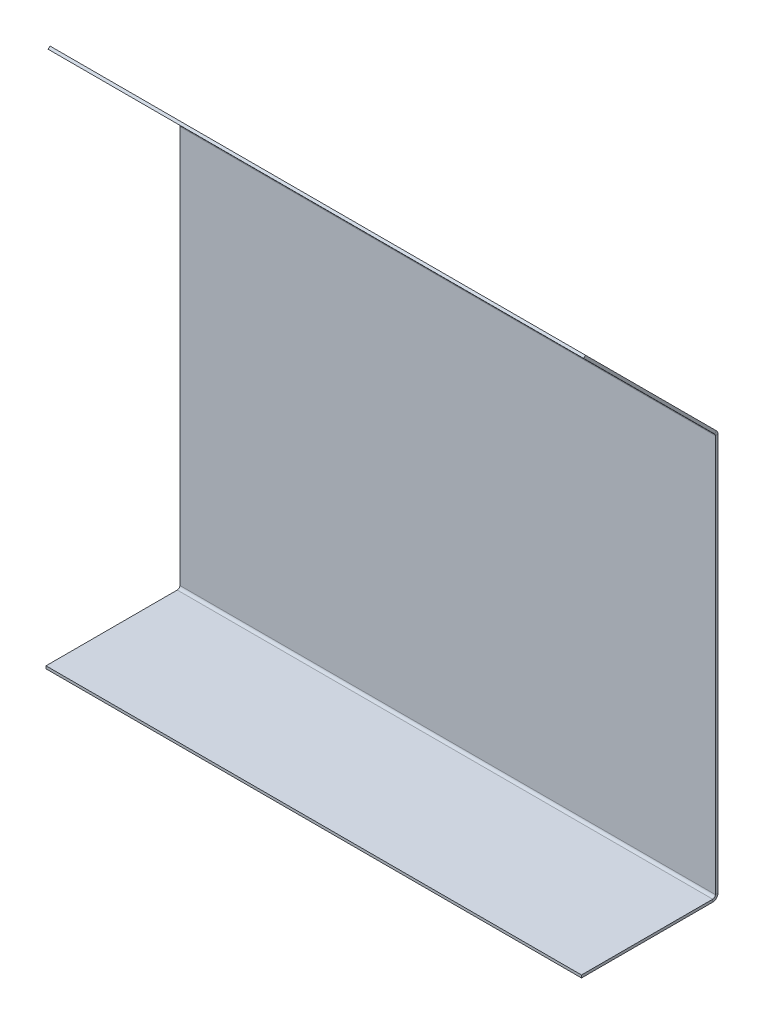
from build123d import *

# Parameters (mm, degrees)
SKETCH22_W                   = 203.2
SKETCH22_H                   = 50.8
BASE_FLANGE2_DEPTH           = 1
EDGE_FLANGE3_STRIP_W         = 7
EDGE_FLANGE3_STRIP_H         = 1
EDGE_FLANGE3_STRIP_CUT_DEPTH = 203.2
EDGE_FLANGE3_DEPTH           = 203.2
SKETCHED_START               = -101.6
SKETCHED_BEND2_DEPTH         = 203.2
SKETCHED_BEND2_2_DEPTH       = 203.2


# Read off the part's stored shape, not the designer's step: Sketched Bend2
# Sheet-metal steps are written as plain solids
with BuildPart() as part:
    # Sketch22 → Base-Flange2 (new body)
    with BuildSketch(Plane(origin=(0, 0, 0), x_dir=(1, 0, 0), z_dir=(0, 1, 0))):
        Rectangle(SKETCH22_W, SKETCH22_H)
    extrude(amount=-BASE_FLANGE2_DEPTH)

    # Edge-Flange3 strip (across the edge) → Edge-Flange3 strip cut (cut)
    with BuildSketch(Plane(origin=(101.6, 0, -26.4), x_dir=(0, 0, 1), z_dir=(-1, 0, 0))):
        with Locations((-1.5, -0.5)):
            Rectangle(EDGE_FLANGE3_STRIP_W, EDGE_FLANGE3_STRIP_H)
    extrude(amount=EDGE_FLANGE3_STRIP_CUT_DEPTH, mode=Mode.SUBTRACT)

    # Edge-Flange3 section (across the edge) → Edge-Flange3 (add)
    with BuildSketch(Plane(origin=(101.6, 0, -26.4), x_dir=(0, 0, 1), z_dir=(-1, 0, 0))):
        with BuildLine():
            Line((0, 1), (0, 223.282))
            Line((0, 223.282), (1, 223.282))
            Line((1, 223.282), (1, 1))
            ThreePointArc((1, 1), (1.292893219, 0.292893219), (2, 0))
            Line((2, 0), (2, -1))
            ThreePointArc((2, -1), (0.585786438, -0.414213562), (0, 1))
        make_face()
    extrude(amount=EDGE_FLANGE3_DEPTH)

    # Sketched Bend2 outline → Sketched Bend2 (cut)
    with BuildSketch(Plane.YZ.offset(SKETCHED_START)):
        with BuildLine():
            ThreePointArc((153.22516494, -25.814213562), (152.576318242, -26.247759065), (151.810951377, -26.4))
            Line((151.810951377, -26.4), (223.282, -26.4))
            Line((223.282, -26.4), (223.282, -25.4))
            Line((223.282, -25.4), (153.639378502, -25.4))
            Line((153.639378502, -25.4), (153.22516494, -25.814213562))
        make_face()
    extrude(amount=SKETCHED_BEND2_DEPTH, mode=Mode.SUBTRACT)

    # Sketched Bend2 2 outline → Sketched Bend2 2 (add)
    with BuildSketch(Plane.YZ.offset(SKETCHED_START)):
        with BuildLine():
            Line((151.810951377, -25.4), (153.639378502, -25.4))
            Line((153.639378502, -25.4), (202.929787528, 23.890409026))
            Line((202.929787528, 23.890409026), (202.222680747, 24.597515807))
            Line((202.222680747, 24.597515807), (152.518058159, -25.107106781))
            ThreePointArc((152.518058159, -25.107106781), (152.19363481, -25.323879533), (151.810951377, -25.4))
        make_face()
    extrude(amount=SKETCHED_BEND2_2_DEPTH)


solid = part.part
